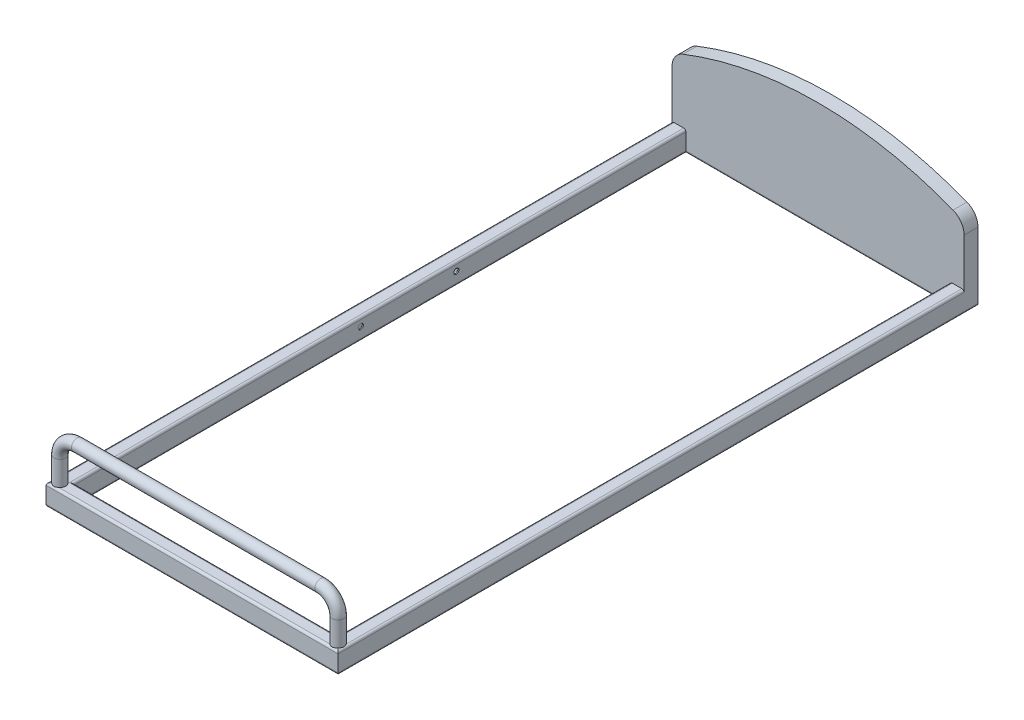
from build123d import *

# Parameters (mm, degrees)
RECTANGULAR_TUBE_CONFIGURED_60_X_40_X_DEPTH      = 837.055512755
RECTANGULAR_TUBE_CONFIGURED_60_X_40_X_DEPTH_BACK = 37.055512755
RECTANGULAR_TUBE_CONFIGURED_60_X_4_4_DEPTH       = 1874.111025509
RECTANGULAR_TUBE_CONFIGURED_60_X_4_6_DEPTH       = 874.111025509
RECTANGULAR_TUBE_CONFIGURED_60_X_4_8_DEPTH       = 1874.111025509
BOSS_EXTRUDE1_REACH                              = 1870.074
BOSS_EXTRUDE1_DIRECTION_2_REACH                  = 1870.074
SKETCH15_R                                       = 16.85
SKETCH15_R_2                                     = 12.85
PIPE_CONFIGURED_33_7_X_4_0_1_DEPTH               = 100
SKETCH15_ON_SEGMENT_2_R                          = 16.85
SKETCH15_ON_SEGMENT_2_R_2                        = 12.85
PIPE_CONFIGURED_33_7_X_4_0_1_2_ANGLE             = 90
SKETCH15_ON_SEGMENT_3_R                          = 16.85
SKETCH15_ON_SEGMENT_3_R_2                        = 12.85
PIPE_CONFIGURED_33_7_X_4_0_1_3_DEPTH             = 700
SKETCH15_ON_SEGMENT_4_R                          = 16.85
SKETCH15_ON_SEGMENT_4_R_2                        = 12.85
PIPE_CONFIGURED_33_7_X_4_0_1_4_ANGLE             = 90
SKETCH15_ON_SEGMENT_5_R                          = 16.85
SKETCH15_ON_SEGMENT_5_R_2                        = 12.85
PIPE_CONFIGURED_33_7_X_4_0_1_5_DEPTH             = 100
TRIM_EXTEND1_START                               = 382
TRIM_EXTEND1_DEPTH                               = 34.85
TRIM_EXTEND1_START_2                             = -418
TRIM_EXTEND1_2_DEPTH                             = 36
SKETCH27_R                                       = 7.5
CUT_EXTRUDE3_DEPTH                               = 10
SKETCH28_R                                       = 7.5
CUT_EXTRUDE4_DEPTH                               = 3


with BuildPart() as part:
    # Sketch12 → Rectangular tube - configured 60 X 40 X 3.2(1) (new, two sides: drawn at the far end of the back side and taken through both)
    with BuildSketch(Plane(origin=(-400, 0, 900), x_dir=(0, 0, -1), z_dir=(1, 0, 0)).offset(-RECTANGULAR_TUBE_CONFIGURED_60_X_40_X_DEPTH_BACK)):
        with BuildLine():
            Line((-13.6, -30), (13.6, -30))
            ThreePointArc((13.6, -30), (18.1254834, -28.1254834), (20, -23.6))
            Line((20, -23.6), (20, 23.6))
            ThreePointArc((20, 23.6), (18.1254834, 28.1254834), (13.6, 30))
            Line((13.6, 30), (-13.6, 30))
            ThreePointArc((-13.6, 30), (-18.1254834, 28.1254834), (-20, 23.6))
            Line((-20, 23.6), (-20, -23.6))
            ThreePointArc((-20, -23.6), (-18.1254834, -28.1254834), (-13.6, -30))
        make_face()
        with BuildLine():
            Line((-13.6, -26.8), (13.6, -26.8))
            ThreePointArc((13.6, -26.8), (15.8627417, -25.8627417), (16.8, -23.6))
            Line((16.8, -23.6), (16.8, 23.6))
            ThreePointArc((16.8, 23.6), (15.8627417, 25.8627417), (13.6, 26.8))
            Line((13.6, 26.8), (-13.6, 26.8))
            ThreePointArc((-13.6, 26.8), (-15.8627417, 25.8627417), (-16.8, 23.6))
            Line((-16.8, 23.6), (-16.8, -23.6))
            ThreePointArc((-16.8, -23.6), (-15.8627417, -25.8627417), (-13.6, -26.8))
        make_face(mode=Mode.SUBTRACT)
    extrude(amount=RECTANGULAR_TUBE_CONFIGURED_60_X_40_X_DEPTH + RECTANGULAR_TUBE_CONFIGURED_60_X_40_X_DEPTH_BACK)

    # Rectangular tube - configured 60 X 4 2
    split(bisect_by=Plane(origin=(-400, 0, 900), x_dir=(0, 1, 0), z_dir=(0.707106781, 0, 0.707106781)), keep=Keep.TOP)

    # Rectangular tube - configured 60 X 4 3
    split(bisect_by=Plane(origin=(400, 0, 900), x_dir=(0, -1, 0), z_dir=(-0.707106781, 0, 0.707106781)), keep=Keep.TOP)


with BuildPart() as body_2:
    # Sketch12 on segment 2 (carried to segment 2) → Rectangular tube - configured 60 X 4 4 (new body)
    with BuildSketch(Plane(origin=(400, 0, 937.055512755), x_dir=(-1, 0, 0), z_dir=(0, 0, -1))):
        with BuildLine():
            Line((-13.6, -30), (13.6, -30))
            ThreePointArc((13.6, -30), (18.1254834, -28.1254834), (20, -23.6))
            Line((20, -23.6), (20, 23.6))
            ThreePointArc((20, 23.6), (18.1254834, 28.1254834), (13.6, 30))
            Line((13.6, 30), (-13.6, 30))
            ThreePointArc((-13.6, 30), (-18.1254834, 28.1254834), (-20, 23.6))
            Line((-20, 23.6), (-20, -23.6))
            ThreePointArc((-20, -23.6), (-18.1254834, -28.1254834), (-13.6, -30))
        make_face()
        with BuildLine():
            Line((-13.6, -26.8), (13.6, -26.8))
            ThreePointArc((13.6, -26.8), (15.8627417, -25.8627417), (16.8, -23.6))
            Line((16.8, -23.6), (16.8, 23.6))
            ThreePointArc((16.8, 23.6), (15.8627417, 25.8627417), (13.6, 26.8))
            Line((13.6, 26.8), (-13.6, 26.8))
            ThreePointArc((-13.6, 26.8), (-15.8627417, 25.8627417), (-16.8, 23.6))
            Line((-16.8, 23.6), (-16.8, -23.6))
            ThreePointArc((-16.8, -23.6), (-15.8627417, -25.8627417), (-13.6, -26.8))
        make_face(mode=Mode.SUBTRACT)
    extrude(amount=RECTANGULAR_TUBE_CONFIGURED_60_X_4_4_DEPTH)

    # Rectangular tube - configured 60 X 4 4 m
    split(bisect_by=Plane(origin=(400, 0, -900), x_dir=(0, 1, 0), z_dir=(0.707106781, 0, 0.707106781)), keep=Keep.TOP)

    # Rectangular tube - configured 60 X 4 5
    split(bisect_by=Plane(origin=(400, 0, 900), x_dir=(0, 1, 0), z_dir=(0.707106781, 0, -0.707106781)), keep=Keep.TOP)


with BuildPart() as body_3:
    # Sketch12 on segment 3 (carried to segment 3) → Rectangular tube - configured 60 X 4 6 (new body)
    with BuildSketch(Plane(origin=(437.055512755, 0, -900), x_dir=(0, 0, 1), z_dir=(-1, 0, 0))):
        with BuildLine():
            Line((-13.6, -30), (13.6, -30))
            ThreePointArc((13.6, -30), (18.1254834, -28.1254834), (20, -23.6))
            Line((20, -23.6), (20, 23.6))
            ThreePointArc((20, 23.6), (18.1254834, 28.1254834), (13.6, 30))
            Line((13.6, 30), (-13.6, 30))
            ThreePointArc((-13.6, 30), (-18.1254834, 28.1254834), (-20, 23.6))
            Line((-20, 23.6), (-20, -23.6))
            ThreePointArc((-20, -23.6), (-18.1254834, -28.1254834), (-13.6, -30))
        make_face()
        with BuildLine():
            Line((-13.6, -26.8), (13.6, -26.8))
            ThreePointArc((13.6, -26.8), (15.8627417, -25.8627417), (16.8, -23.6))
            Line((16.8, -23.6), (16.8, 23.6))
            ThreePointArc((16.8, 23.6), (15.8627417, 25.8627417), (13.6, 26.8))
            Line((13.6, 26.8), (-13.6, 26.8))
            ThreePointArc((-13.6, 26.8), (-15.8627417, 25.8627417), (-16.8, 23.6))
            Line((-16.8, 23.6), (-16.8, -23.6))
            ThreePointArc((-16.8, -23.6), (-15.8627417, -25.8627417), (-13.6, -26.8))
        make_face(mode=Mode.SUBTRACT)
    extrude(amount=RECTANGULAR_TUBE_CONFIGURED_60_X_4_6_DEPTH)

    # Rectangular tube - configured 60 X 4 6 m
    split(bisect_by=Plane(origin=(-400, 0, -900), x_dir=(0, 1, 0), z_dir=(0.707106781, 0, -0.707106781)), keep=Keep.TOP)

    # Rectangular tube - configured 60 X 4 7
    split(bisect_by=Plane(origin=(400, 0, -900), x_dir=(0, -1, 0), z_dir=(-0.707106781, 0, -0.707106781)), keep=Keep.TOP)

    # Boss-Extrude1: up to this face of the body (flat: up to its plane)
    boss_extrude1_end = Plane(body_3.part.faces().sort_by_distance((0, 0, -880))[0])
    # Sketch13 → Boss-Extrude1 (add, up to the picked face)
    with BuildSketch(Plane.XY.offset(-900), mode=Mode.PRIVATE) as boss_extrude1_sk1:
        with BuildLine():
            Line((-420, 0), (-420, 166.466305982))
            ThreePointArc((-420, 166.466305982), (-411.297011379, 194.654190811), (-388.217725954, 213.029322004))
            ThreePointArc((-388.217725954, 213.029322004), (0, 286.271070586), (388.217725954, 213.029322004))
            ThreePointArc((388.217725954, 213.029322004), (411.297011379, 194.654190811), (420, 166.466305982))
            Line((420, 166.466305982), (420, 0))
            Line((420, 0), (-420, 0))
        make_face()
    boss_extrude1_tool1 = split(extrude(boss_extrude1_sk1.sketch, amount=BOSS_EXTRUDE1_REACH, mode=Mode.PRIVATE), bisect_by=boss_extrude1_end, keep=Keep.BOTH, mode=Mode.PRIVATE)

    add(body_2.part)  # Boss-Extrude1 merges body 2


with BuildPart() as body_4:
    # Sketch12 on segment 4 (carried to segment 4) → Rectangular tube - configured 60 X 4 8 (new body)
    with BuildSketch(Plane(origin=(-400, 0, -937.055512755), x_dir=(1, 0, 0), z_dir=(0, 0, 1))):
        with BuildLine():
            Line((-13.6, -30), (13.6, -30))
            ThreePointArc((13.6, -30), (18.1254834, -28.1254834), (20, -23.6))
            Line((20, -23.6), (20, 23.6))
            ThreePointArc((20, 23.6), (18.1254834, 28.1254834), (13.6, 30))
            Line((13.6, 30), (-13.6, 30))
            ThreePointArc((-13.6, 30), (-18.1254834, 28.1254834), (-20, 23.6))
            Line((-20, 23.6), (-20, -23.6))
            ThreePointArc((-20, -23.6), (-18.1254834, -28.1254834), (-13.6, -30))
        make_face()
        with BuildLine():
            Line((-13.6, -26.8), (13.6, -26.8))
            ThreePointArc((13.6, -26.8), (15.8627417, -25.8627417), (16.8, -23.6))
            Line((16.8, -23.6), (16.8, 23.6))
            ThreePointArc((16.8, 23.6), (15.8627417, 25.8627417), (13.6, 26.8))
            Line((13.6, 26.8), (-13.6, 26.8))
            ThreePointArc((-13.6, 26.8), (-15.8627417, 25.8627417), (-16.8, 23.6))
            Line((-16.8, 23.6), (-16.8, -23.6))
            ThreePointArc((-16.8, -23.6), (-15.8627417, -25.8627417), (-13.6, -26.8))
        make_face(mode=Mode.SUBTRACT)
    extrude(amount=RECTANGULAR_TUBE_CONFIGURED_60_X_4_8_DEPTH)

    # Rectangular tube - configured 60 X 4 8 m
    split(bisect_by=Plane(origin=(-400, 0, -900), x_dir=(0, -1, 0), z_dir=(-0.707106781, 0, 0.707106781)), keep=Keep.TOP)

    # Rectangular tube - configured 60 X 4 9
    split(bisect_by=Plane(origin=(-400, 0, 900), x_dir=(0, -1, 0), z_dir=(-0.707106781, 0, -0.707106781)), keep=Keep.TOP)


with BuildPart() as body_3_1:
    add(body_3.part)

    add(body_4.part)  # Boss-Extrude1 merges body 4
    add(boss_extrude1_tool1.solids().sort_by(Axis((0, 130.141696, -900), (0, 0, 1)))[0])

    # Boss-Extrude1 direction 2: up to this face of the body (flat: up to its plane)
    boss_extrude1_direction_2_end = Plane(body_3_1.part.faces().sort_by_distance((0, 0, -920))[0])
    # Sketch13 → Boss-Extrude1 direction 2 (add, up to the picked face)
    with BuildSketch(Plane.XY.offset(-900), mode=Mode.PRIVATE) as boss_extrude1_direction_2_sk1:
        with BuildLine():
            Line((-420, 0), (-420, 166.466305982))
            ThreePointArc((-420, 166.466305982), (-411.297011379, 194.654190811), (-388.217725954, 213.029322004))
            ThreePointArc((-388.217725954, 213.029322004), (0, 286.271070586), (388.217725954, 213.029322004))
            ThreePointArc((388.217725954, 213.029322004), (411.297011379, 194.654190811), (420, 166.466305982))
            Line((420, 166.466305982), (420, 0))
            Line((420, 0), (-420, 0))
        make_face()
    boss_extrude1_direction_2_tool1 = split(extrude(boss_extrude1_direction_2_sk1.sketch, amount=-BOSS_EXTRUDE1_DIRECTION_2_REACH, mode=Mode.PRIVATE), bisect_by=boss_extrude1_direction_2_end, keep=Keep.BOTH, mode=Mode.PRIVATE)
    add(boss_extrude1_direction_2_tool1.solids().sort_by(Axis((0, 130.141696, -900), (0, 0, -1)))[0])

    # Sketch27 → Cut-Extrude3 (cut)
    with BuildSketch(Plane.ZY.offset(-380)):
        with Locations((-220, 6.4)):
            Circle(SKETCH27_R)
    cut_extrude3 = extrude(amount=-CUT_EXTRUDE3_DEPTH, mode=Mode.SUBTRACT)

    # Mirror1: Cut-Extrude3 across plane
    add(cut_extrude3.mirror(Plane(origin=(0, 0, 0), x_dir=(0, 0, 1), z_dir=(1, 0, 0))), mode=Mode.SUBTRACT)

    # Sketch28 → Cut-Extrude4 (cut)
    with BuildSketch(Plane.ZY.offset(-380)):
        with Locations((55, 6.4)):
            Circle(SKETCH28_R)
    cut_extrude4 = extrude(amount=-CUT_EXTRUDE4_DEPTH, mode=Mode.SUBTRACT)

    # Mirror2: Cut-Extrude4 across plane
    add(cut_extrude4.mirror(Plane(origin=(0, 0, 0), x_dir=(0, 0, 1), z_dir=(1, 0, 0))), mode=Mode.SUBTRACT)


with BuildPart() as body_3_2:
    # Sketch15 → Pipe - configured 33.7 X 4.0(1) (new body)
    with BuildSketch(Plane(origin=(-400, 0, 900), x_dir=(-1, 0, 0), z_dir=(0, 1, 0))):
        Circle(SKETCH15_R)
        Circle(SKETCH15_R_2, mode=Mode.SUBTRACT)
    extrude(amount=PIPE_CONFIGURED_33_7_X_4_0_1_DEPTH)

    # Trim_Extend1 2 outline → Trim_Extend1 2 (cut)
    with BuildSketch(Plane.YZ.offset(TRIM_EXTEND1_START_2)):
        with BuildLine():
            ThreePointArc((29.11304873, 883.149416406), (29.774281815, 884.715291104), (30, 886.4))
            Line((30, 886.4), (30, 913.6))
            ThreePointArc((30, 913.6), (29.774281815, 915.284708896), (29.11304873, 916.850583594))
            Line((29.11304873, 916.850583594), (28.435334041, 918))
            Line((28.435334041, 918), (0, 918))
            Line((0, 918), (0, 882))
            Line((0, 882), (28.435334041, 882))
            Line((28.435334041, 882), (29.11304873, 883.149416406))
        make_face()
    extrude(amount=TRIM_EXTEND1_2_DEPTH, mode=Mode.SUBTRACT)


with BuildPart() as body_4_2:
    # Sketch15 on segment 2 (carried to the start of arc 2) → Pipe - configured 33.7 X 4.0_1 2 (revolve)
    with BuildSketch(Plane(origin=(-400, 100, 900), x_dir=(-1, 0, 0), z_dir=(0, 1, 0))):
        Circle(SKETCH15_ON_SEGMENT_2_R)
        Circle(SKETCH15_ON_SEGMENT_2_R_2, mode=Mode.SUBTRACT)
    revolve(axis=Axis((-350, 100, 900), (0, 0, -1)), revolution_arc=PIPE_CONFIGURED_33_7_X_4_0_1_2_ANGLE)


with BuildPart() as body_5:
    # Sketch15 on segment 3 (carried to segment 3) → Pipe - configured 33.7 X 4.0_1 3 (new body)
    with BuildSketch(Plane(origin=(-350, 150, 900), x_dir=(0, 1, 0), z_dir=(1, 0, 0))):
        Circle(SKETCH15_ON_SEGMENT_3_R)
        Circle(SKETCH15_ON_SEGMENT_3_R_2, mode=Mode.SUBTRACT)
    extrude(amount=PIPE_CONFIGURED_33_7_X_4_0_1_3_DEPTH)


with BuildPart() as body_6:
    # Sketch15 on segment 4 (carried to the start of arc 4) → Pipe - configured 33.7 X 4.0_1 4 (revolve)
    with BuildSketch(Plane(origin=(350, 150, 900), x_dir=(0, 1, 0), z_dir=(1, 0, 0))):
        Circle(SKETCH15_ON_SEGMENT_4_R)
        Circle(SKETCH15_ON_SEGMENT_4_R_2, mode=Mode.SUBTRACT)
    revolve(axis=Axis((350, 100, 900), (0, 0, -1)), revolution_arc=PIPE_CONFIGURED_33_7_X_4_0_1_4_ANGLE)


with BuildPart() as body_7:
    # Sketch15 on segment 5 (carried to segment 5) → Pipe - configured 33.7 X 4.0_1 5 (new body)
    with BuildSketch(Plane(origin=(400, 0, 900), x_dir=(-1, 0, 0), z_dir=(0, 1, 0))):
        Circle(SKETCH15_ON_SEGMENT_5_R)
        Circle(SKETCH15_ON_SEGMENT_5_R_2, mode=Mode.SUBTRACT)
    extrude(amount=PIPE_CONFIGURED_33_7_X_4_0_1_5_DEPTH)

    # Trim/Extend1: read off the stored shape, not the designer's step
    # Trim/Extend1 outline → Trim/Extend1 (cut)
    with BuildSketch(Plane.YZ.offset(TRIM_EXTEND1_START)):
        with BuildLine():
            ThreePointArc((29.11304873, 883.149416406), (29.774281815, 884.715291104), (30, 886.4))
            Line((30, 886.4), (30, 913.6))
            ThreePointArc((30, 913.6), (29.774281815, 915.284708896), (29.11304873, 916.850583594))
            Line((29.11304873, 916.850583594), (28.435334041, 918))
            Line((28.435334041, 918), (0, 918))
            Line((0, 918), (0, 882))
            Line((0, 882), (28.435334041, 882))
            Line((28.435334041, 882), (29.11304873, 883.149416406))
        make_face()
    extrude(amount=TRIM_EXTEND1_DEPTH, mode=Mode.SUBTRACT)


solid = Compound([part.part, body_3_1.part, body_3_2.part, body_4_2.part, body_5.part, body_6.part, body_7.part])
